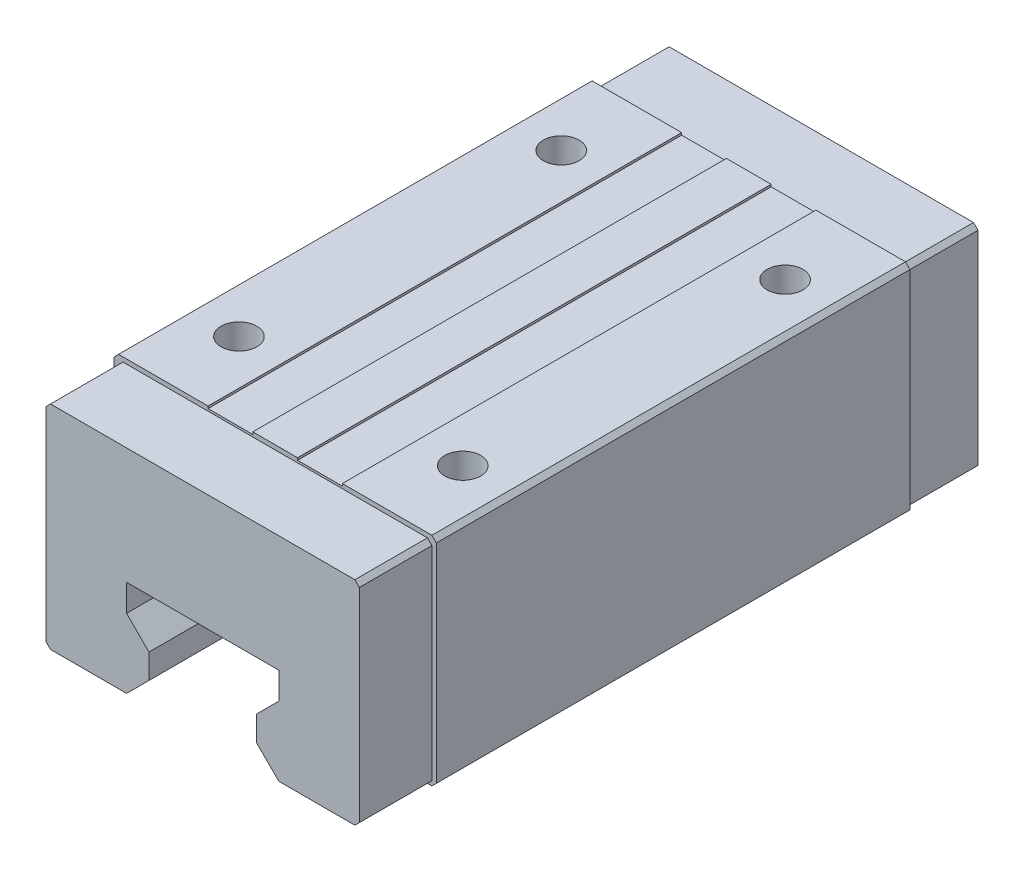
from build123d import *

# Parameters (mm, degrees)
EXTRUDE_1_DEPTH     = 138.2
EXTRUDE_2_DEPTH     = 52.9
SKETCH_4_R          = 4
CUT_EXTRUDE_1_DEPTH = 12
CHAMFER_1_SIZE      = 1


with BuildPart() as part:
    # 草图1 → 凸台-拉伸1 (new body)
    with BuildSketch(Plane.XY):
        Polygon((-35, 47.5), (35, 47.5), (35, 0), (17, 0), (12, 5), (12, 10.5), (17, 15.5), (17, 21.5), (-17, 21.5), (-17, 15.5), (-12, 10.5), (-12, 5), (-17, 0), (-35, 0), align=None)
    extrude(amount=EXTRUDE_1_DEPTH)

    # 草图2 → 凸台-拉伸2 (add, symmetric)
    with BuildSketch(Plane.XY.offset(69.1)):
        Polygon((-36, 0), (-35, 0), (-35, 47.5), (35, 47.5), (35, 0), (36, 0), (36, 48.5), (15, 48.5), (15, 48), (5, 48), (5, 48.5), (-5, 48.5), (-5, 48), (-15, 48), (-15, 48.5), (-36, 48.5), align=None)
    extrude(amount=EXTRUDE_2_DEPTH, both=True)

    # 草图4 → 切除-拉伸1 (cut)
    with BuildSketch(Plane(origin=(0, 48.5, 0), x_dir=(1, 0, 0), z_dir=(0, 1, 0))):
        with Locations(Location((25, -33.1, 0), (0, 0, 270))):
            Circle(SKETCH_4_R)
        with Locations(Location((25, -105.1, 0), (0, 0, 270))):
            Circle(SKETCH_4_R)
        with Locations(Location((-25, -105.1, 0), (0, 0, 90))):
            Circle(SKETCH_4_R)
        with Locations(Location((-25, -33.1, 0), (0, 0, 90))):
            Circle(SKETCH_4_R)
    extrude(amount=-CUT_EXTRUDE_1_DEPTH, mode=Mode.SUBTRACT)

    # 倒角1
    chamfer_1_edges = [part.edges().sort_by_distance(p)[0] for p in [
        (35, 47.5, 8.1),
        (-35, 47.5, 8.1),
        (35, 0, 8.1),
        (-35, 0, 8.1),
        (36, 0, 69.1),
        (35, 0, 130.1),
        (-35, 0, 130.1),
        (-36, 0, 69.1),
        (36, 48.5, 69.1),
        (-36, 48.5, 69.1),
        (35, 47.5, 130.1),
        (-35, 47.5, 130.1),
    ]]
    chamfer(chamfer_1_edges, length=CHAMFER_1_SIZE - 0.0001)  # a hair under: the kernel refuses the full size


solid = part.part
